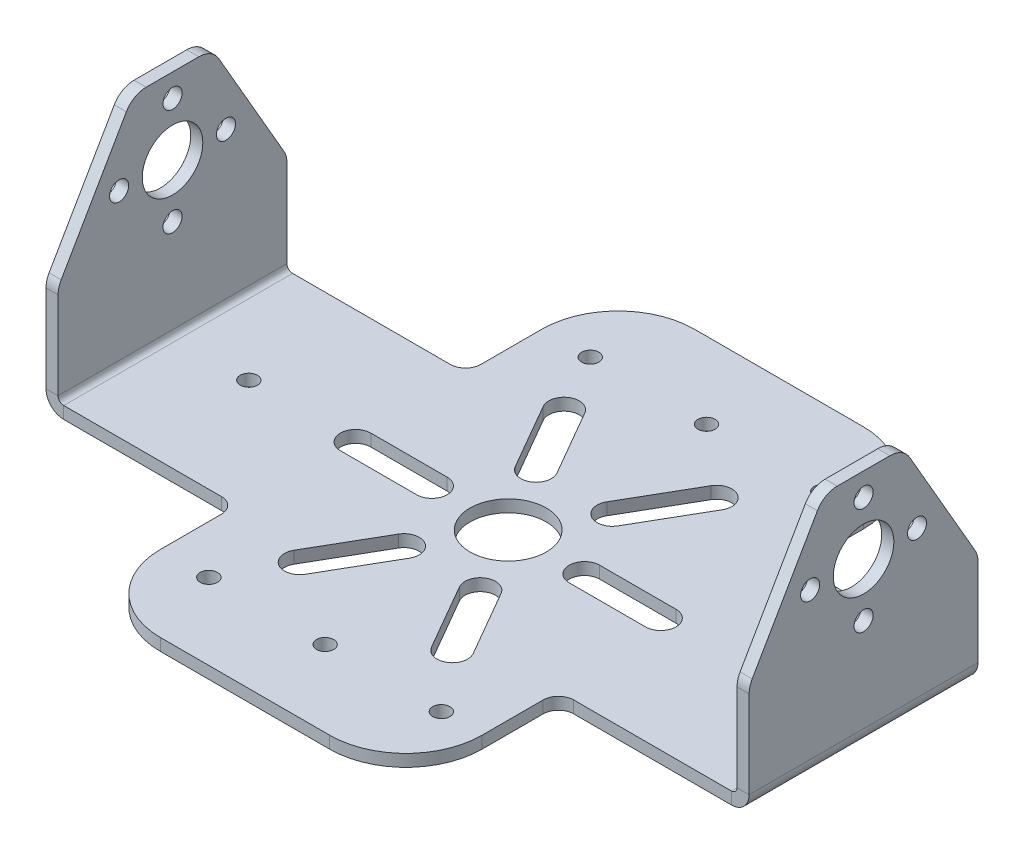
from build123d import *
from OCP.BRepFilletAPI import BRepFilletAPI_MakeChamfer

# Parameters (mm, degrees)
BASE_FLANGE1_DEPTH             = 70
SKETCH7_W                      = 25
SKETCH7_H                      = 20
CUT_EXTRUDE1_DEPTH             = 90.017176187
MIRROR10_COPY_1_SKETCH_W       = 25
MIRROR10_COPY_1_SKETCH_H       = 20
MIRROR10_COPY_1_DEPTH          = 90.017176187
FILLET3_R                      = 10
FILLET4_R                      = 2
TAP_DRILL_FOR_4_40_TAP1_D      = 2.2606
SKETCH11_R                     = 5
CUT_EXTRUDE2_DEPTH             = 10
CUT_EXTRUDE3_DEPTH             = 10
CIRPATTERN1_COUNT              = 6
F_5_16_0_3125_DIAMETER_HOLE1_D = 7.9375
TAP_DRILL_FOR_M3X0_5_TAP1_D    = 2.5
CIRPATTERN2_COUNT              = 4
CHAMFER2_SIZE                  = 17
CHAMFER2_SIZE2                 = 9.814954576
FILLET5_R                      = 3
CHAMFER3_SIZE                  = 17
CHAMFER3_SIZE2                 = 9.814954576
FILLET6_R                      = 3


# Sheet-metal steps are written as plain solids
with BuildPart() as part:
    # Sketch2 → Base-Flange1 (new body)
    with BuildSketch(Plane.XY):
        with BuildLine():
            Line((-44.5, 30), (-44.5, 0.7366))
            ThreePointArc((-44.5, 0.7366), (-44.284254855, 0.215745145), (-43.7634, 0))
            Line((-43.7634, 0), (43.7634, 0))
            ThreePointArc((43.7634, 0), (44.284254855, 0.215745145), (44.5, 0.7366))
            Line((44.5, 0.7366), (44.5, 30))
            Line((44.5, 30), (46.0875, 30))
            Line((46.0875, 30), (46.0875, 0.7366))
            ThreePointArc((46.0875, 0.7366), (45.40678687, -0.90678687), (43.7634, -1.5875))
            Line((43.7634, -1.5875), (-43.7634, -1.5875))
            ThreePointArc((-43.7634, -1.5875), (-45.40678687, -0.90678687), (-46.0875, 0.7366))
            Line((-46.0875, 0.7366), (-46.0875, 30))
            Line((-46.0875, 30), (-44.5, 30))
        make_face()
    extrude(amount=BASE_FLANGE1_DEPTH)

    # Sketch7 → Cut-Extrude1 (cut, symmetric)
    with BuildSketch(Plane(origin=(0, 0, 0), x_dir=(1, 0, 0), z_dir=(0, 1, 0))):
        with Locations((-33.5875, -60)):
            Rectangle(SKETCH7_W, SKETCH7_H)
    cut_extrude1 = extrude(amount=CUT_EXTRUDE1_DEPTH, both=True, mode=Mode.SUBTRACT)

    # Mirror9: Cut-Extrude1 across plane
    add(cut_extrude1.mirror(Plane.ZY), mode=Mode.SUBTRACT)

    # Mirror10: Cut-Extrude1 across plane
    add(cut_extrude1.mirror(Plane(origin=(0, 0, 35), x_dir=(1, 0, 0), z_dir=(0, 0, -1))), mode=Mode.SUBTRACT)

    # Mirror10 copy 1 sketch → Mirror10 copy 1 (cut, symmetric)
    with BuildSketch(Plane(origin=(0, 0, 70), x_dir=(-1, 0, 0), z_dir=(0, 1, 0))):
        with Locations((-33.5875, -60)):
            Rectangle(MIRROR10_COPY_1_SKETCH_W, MIRROR10_COPY_1_SKETCH_H)
    extrude(amount=MIRROR10_COPY_1_DEPTH, both=True, mode=Mode.SUBTRACT)

    # Fillet3
    fillet3_edges = [part.edges().sort_by_distance(p)[0] for p in [
        (21.0875, -0.79375, 0),
        (-21.0875, -0.79375, 0),
        (-21.0875, -0.79375, 70),
        (21.0875, -0.79375, 70),
    ]]
    fillet(fillet3_edges, radius=FILLET3_R)

    # Fillet4
    fillet4_edges = [part.edges().sort_by_distance(p)[0] for p in [
        (21.0875, -0.79375, 20),
        (-21.0875, -0.79375, 20),
        (-21.0875, -0.79375, 50),
        (21.0875, -0.79375, 50),
    ]]
    fillet(fillet4_edges, radius=FILLET4_R)

    # Tap Drill for #4-40 Tap1 (through all)
    with Locations(Plane(origin=(0, 0, 0), x_dir=(1, 0, 0), z_dir=(0, 1, 0))):
        with Locations((0.5, -10), (0.5, -60), (-34.5, -35), (35.5, -35), (-14.74, -60), (15.74, -60), (-14.74, -10), (15.74, -10)):
            Hole(TAP_DRILL_FOR_4_40_TAP1_D / 2)

    # Sketch11 → Cut-Extrude2 (cut)
    with BuildSketch(Plane(origin=(0, 0, 0), x_dir=(1, 0, 0), z_dir=(0, 1, 0))):
        with Locations(Location((-0.5, -35, 0), (0, 0, 270))):
            Circle(SKETCH11_R)
    extrude(amount=-CUT_EXTRUDE2_DEPTH, mode=Mode.SUBTRACT)

    # Sketch12 → Cut-Extrude3 (cut)
    with BuildSketch(Plane(origin=(0, 0, 0), x_dir=(1, 0, 0), z_dir=(0, 1, 0))):
        with BuildLine():
            Line((9.5, -33), (19.5, -33))
            ThreePointArc((19.5, -33), (21.5, -35), (19.5, -37))
            Line((19.5, -37), (9.5, -37))
            ThreePointArc((9.5, -37), (7.5, -35), (9.5, -33))
        make_face()
    cut_extrude3 = extrude(amount=-CUT_EXTRUDE3_DEPTH, mode=Mode.SUBTRACT)

    # CirPattern1: Cut-Extrude3 ×6 about axis
    cirpattern1_axis = Axis((-0.5, 0, 35), (0, 1, 0))
    for i in range(1, CIRPATTERN1_COUNT):
        add(cut_extrude3.rotate(cirpattern1_axis, i * 360 / CIRPATTERN1_COUNT), mode=Mode.SUBTRACT)

    # 5/16 (0.3125) Diameter Hole1 (through all)
    with Locations(Plane(origin=(46.0875, 0, 0), x_dir=(0, 0, -1), z_dir=(1, 0, 0))):
        with Locations((-35, 20)):
            Hole(F_5_16_0_3125_DIAMETER_HOLE1_D / 2)

    # Tap Drill for M3x0.5 Tap1 (through all)
    with Locations(Plane(origin=(46.0875, 0, 0), x_dir=(0, 0, -1), z_dir=(1, 0, 0))):
        with Locations((-35, 13)):
            tap_drill_for_m3x0_5_tap1 = Hole(TAP_DRILL_FOR_M3X0_5_TAP1_D / 2)

    # CirPattern2: Tap Drill for M3x0.5 Tap1 ×4 about axis
    cirpattern2_axis = Axis((0, 20, 35), (1, 0, 0))
    for i in range(1, CIRPATTERN2_COUNT):
        add(tap_drill_for_m3x0_5_tap1.rotate(cirpattern2_axis, i * 360 / CIRPATTERN2_COUNT), mode=Mode.SUBTRACT)

    # Chamfer2: one chamfer whose edges measure the first distance from different faces: ONE call of the kernel's chamfer builder (chamfer() names one face for all edges)
    chamfer2_edges_1 = [part.edges().sort_by_distance(p)[0] for p in [
        (45.29375, 30, 20),
    ]]
    chamfer2_side_1 = [part.faces().sort_by_distance(p)[0] for p in [
        (33.42545, -0.390739063, 20),
    ]]
    chamfer2_edges_2 = [part.edges().sort_by_distance(p)[0] for p in [
        (45.29375, 30, 50),
    ]]
    chamfer2_side_2 = [part.faces().sort_by_distance(p)[0] for p in [
        (33.42545, -0.390739063, 50),
    ]]
    chamfer2 = BRepFilletAPI_MakeChamfer(part.part.solid().wrapped)
    for e in chamfer2_edges_1:
        chamfer2.Add(CHAMFER2_SIZE, CHAMFER2_SIZE2, e.wrapped, chamfer2_side_1[0].wrapped)  # the first distance lies on this face
    for e in chamfer2_edges_2:
        chamfer2.Add(CHAMFER2_SIZE, CHAMFER2_SIZE2, e.wrapped, chamfer2_side_2[0].wrapped)  # the first distance lies on this face
    add(Compound.cast(chamfer2.Shape()), mode=Mode.REPLACE)

    # Fillet5
    fillet5_edges = [part.edges().sort_by_distance(p)[0] for p in [
        (45.29375, 13, 20),
        (45.29375, 30, 40.185045424),
        (45.29375, 30, 29.814954576),
        (45.29375, 13, 50),
    ]]
    fillet(fillet5_edges, radius=FILLET5_R)

    # Chamfer3: one chamfer whose edges measure the first distance from different faces: ONE call of the kernel's chamfer builder (chamfer() names one face for all edges)
    chamfer3_edges_1 = [part.edges().sort_by_distance(p)[0] for p in [
        (-45.29375, 30, 20),
    ]]
    chamfer3_side_1 = [part.faces().sort_by_distance(p)[0] for p in [
        (-33.42545, -0.390739063, 20),
    ]]
    chamfer3_edges_2 = [part.edges().sort_by_distance(p)[0] for p in [
        (-45.29375, 30, 50),
    ]]
    chamfer3_side_2 = [part.faces().sort_by_distance(p)[0] for p in [
        (-33.42545, -0.390739063, 50),
    ]]
    chamfer3 = BRepFilletAPI_MakeChamfer(part.part.solid().wrapped)
    for e in chamfer3_edges_1:
        chamfer3.Add(CHAMFER3_SIZE, CHAMFER3_SIZE2, e.wrapped, chamfer3_side_1[0].wrapped)  # the first distance lies on this face
    for e in chamfer3_edges_2:
        chamfer3.Add(CHAMFER3_SIZE, CHAMFER3_SIZE2, e.wrapped, chamfer3_side_2[0].wrapped)  # the first distance lies on this face
    add(Compound.cast(chamfer3.Shape()), mode=Mode.REPLACE)

    # Fillet6
    fillet6_edges = [part.edges().sort_by_distance(p)[0] for p in [
        (-45.29375, 13, 50),
        (-45.29375, 30, 29.814954576),
        (-45.29375, 30, 40.185045424),
        (-45.29375, 13, 20),
    ]]
    fillet(fillet6_edges, radius=FILLET6_R)


solid = part.part
